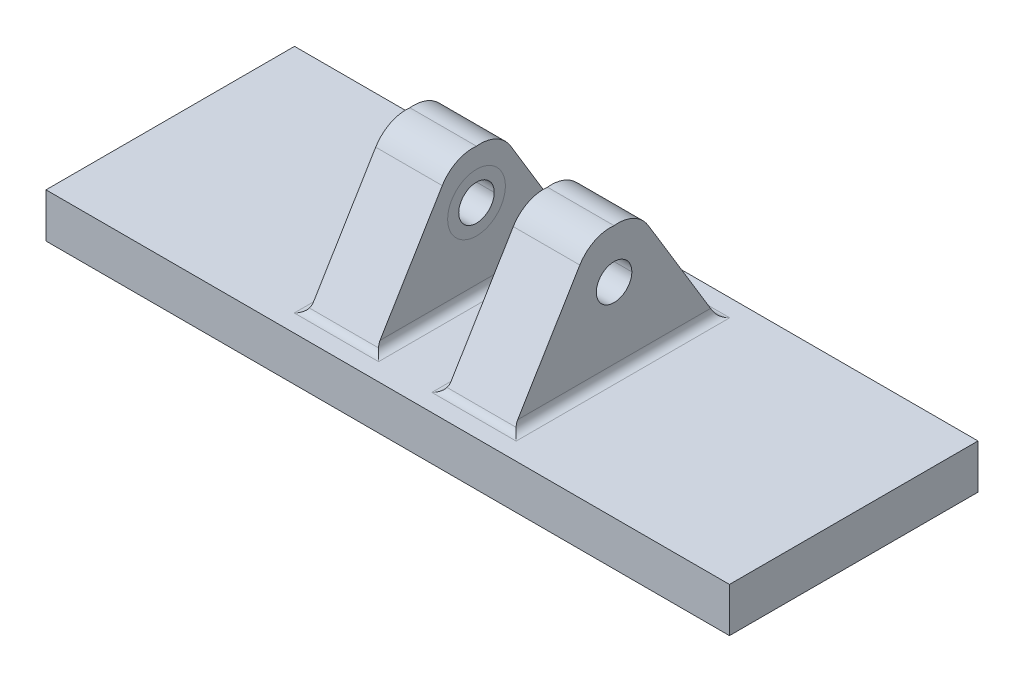
from build123d import *

# Parameters (mm, degrees)
SKETCH1_W           = 154
SKETCH1_H           = 56
BOSS_EXTRUDE1_DEPTH = 10
BOSS_EXTRUDE2_START = 8
SKETCH2_R           = 4
BOSS_EXTRUDE2_DEPTH = 15
FILLET1_R           = 2


with BuildPart() as part:
    # Sketch1 → Boss-Extrude1 (new body)
    with BuildSketch(Plane(origin=(0, 0, 0), x_dir=(1, 0, 0), z_dir=(0, 1, 0))):
        Rectangle(SKETCH1_W, SKETCH1_H)
    extrude(amount=BOSS_EXTRUDE1_DEPTH)

    # Sketch2 → Boss-Extrude2 (add)
    with BuildSketch(Plane(origin=(0, 0, 0), x_dir=(0, 0, -1), z_dir=(1, 0, 0)).offset(BOSS_EXTRUDE2_START)):
        with BuildLine():
            Line((-22.934523003, 10), (-7.714285949, 35.180316317))
            ThreePointArc((-7.714285949, 35.180316317), (-4.414778361, 38.221001797), (0, 39.022407146))
            ThreePointArc((0, 39.022407146), (4.414778361, 38.221001797), (7.714285949, 35.180316317))
            Line((7.714285949, 35.180316317), (22.934523003, 10))
            Line((22.934523003, 10), (-22.934523003, 10))
        make_face()
        with Locations((0, 28)):
            Circle(SKETCH2_R, mode=Mode.SUBTRACT)
    boss_extrude2 = extrude(amount=BOSS_EXTRUDE2_DEPTH)

    # Mirror1: Boss-Extrude2 across plane
    add(boss_extrude2.mirror(Plane(origin=(0, 0, 0), x_dir=(0, 0, 1), z_dir=(1, 0, 0))))

    # Fillet1
    fillet1_edges = [part.edges().sort_by_distance(p)[0] for p in [
        (15.5, 10, 22.934523003),
        (23, 10, 0),
        (8, 10, 0),
        (15.5, 10, -22.934523003),
        (-15.5, 10, -22.934523003),
        (-23, 10, 0),
        (-15.5, 10, 22.934523003),
        (-8, 10, 0),
    ]]
    fillet(fillet1_edges, radius=FILLET1_R)


solid = part.part
